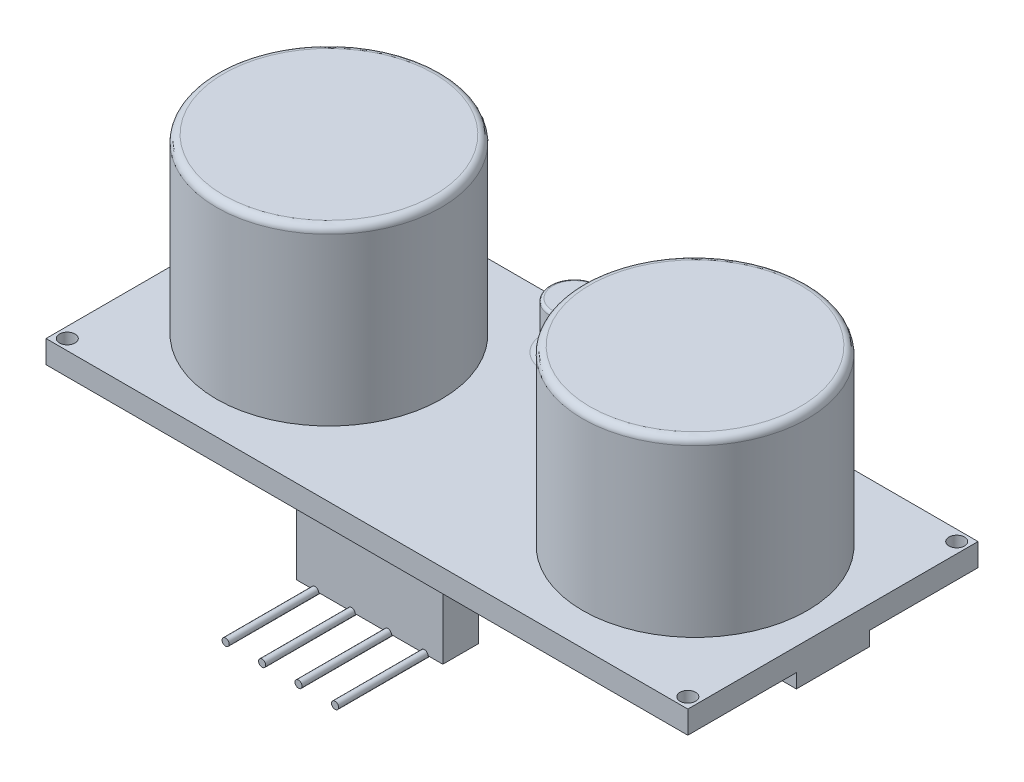
from build123d import *

# Parameters (mm, degrees)
SKETCH1_W           = 45.23
SKETCH1_H           = 20.45
BOSS_EXTRUDE1_DEPTH = 1.6
SKETCH2_R           = 7.92
BOSS_EXTRUDE2_DEPTH = 12.2
BOSS_EXTRUDE3_DEPTH = 3.3
SKETCH4_W           = 4
SKETCH4_H           = 10.1
SKETCH4_W_2         = 8.68
SKETCH4_H_2         = 5.15
SKETCH4_W_3         = 10.3
SKETCH4_H_3         = 2.53
BOSS_EXTRUDE4_DEPTH = 1
SKETCH5_W           = 10.3
SKETCH5_H           = 2.53
BOSS_EXTRUDE5_DEPTH = 3.5
SKETCH6_R           = 0.25
BOSS_EXTRUDE6_DEPTH = 6.3
FILLET1_R           = 0.5
FILLET2_R           = 0.5
FILLET3_R           = 0.2
FILLET4_R           = 0.5
SKETCH7_R           = 0.55
CUT_EXTRUDE1_DEPTH  = 6.3


with BuildPart() as part:
    # Sketch1 → Boss-Extrude1 (new body)
    with BuildSketch(Plane(origin=(0, 0, 0), x_dir=(1, 0, 0), z_dir=(0, 1, 0))):
        with Locations((-22.615, 10.225)):
            Rectangle(SKETCH1_W, SKETCH1_H)
    extrude(amount=BOSS_EXTRUDE1_DEPTH)

    # Sketch2 → Boss-Extrude2 (add)
    with BuildSketch(Plane(origin=(0, 1.6, 0), x_dir=(1, 0, 0), z_dir=(0, 1, 0))):
        with Locations(Location((-35.515, 10.225, 0), (0, 0, 270))):
            Circle(SKETCH2_R)
        with Locations(Location((-9.715, 10.225, 0), (0, 0, 270))):
            Circle(SKETCH2_R)
    extrude(amount=BOSS_EXTRUDE2_DEPTH)

    # Sketch3 → Boss-Extrude3 (add)
    with BuildSketch(Plane(origin=(0, 1.6, 0), x_dir=(1, 0, 0), z_dir=(0, 1, 0))):
        with BuildLine():
            Line((-25.77, 19.5), (-19.46, 19.5))
            ThreePointArc((-19.46, 19.5), (-17.74, 17.78), (-19.46, 16.06))
            Line((-19.46, 16.06), (-25.77, 16.06))
            ThreePointArc((-25.77, 16.06), (-27.49, 17.78), (-25.77, 19.5))
        make_face()
    extrude(amount=BOSS_EXTRUDE3_DEPTH)

    # Sketch4 → Boss-Extrude4 (add)
    with BuildSketch(Plane.XZ):
        with Locations((-40.73, -10.225)):
            Rectangle(SKETCH4_W, SKETCH4_H)
        with Locations((-22.615, -10.225)):
            Rectangle(SKETCH4_W_2, SKETCH4_H_2)
        with Locations((-4.34, -10.225)):
            Rectangle(SKETCH4_W_2, SKETCH4_H_2)
        with Locations((-22.615, -1.465)):
            Rectangle(SKETCH4_W_3, SKETCH4_H_3)
    extrude(amount=BOSS_EXTRUDE4_DEPTH)

    # Sketch5 → Boss-Extrude5 (add)
    with BuildSketch(Plane.XZ.offset(1)):
        with Locations((-22.615, -1.465)):
            Rectangle(SKETCH5_W, SKETCH5_H)
    extrude(amount=BOSS_EXTRUDE5_DEPTH)

    # Sketch6 → Boss-Extrude6 (add)
    with BuildSketch(Plane.XY.offset(-0.2)):
        with Locations((-21.334010663, -4.5)):
            Circle(SKETCH6_R)
        with Locations((-18.759010663, -4.5)):
            Circle(SKETCH6_R)
        with Locations(Location((-23.895989337, -4.5, 0), (0, 0, 180))):
            Circle(SKETCH6_R)
        with Locations(Location((-26.470989337, -4.5, 0), (0, 0, 180))):
            Circle(SKETCH6_R)
    extrude(amount=BOSS_EXTRUDE6_DEPTH)

    # Fillet1
    # the kernel refuses this fillet: 0.5 mm, written as the material it adds along each edge
    with BuildSketch(Plane(origin=(-24.970989337, -4.5, -0.2), x_dir=(0, 0, -1), z_dir=(-1, 0, 0))) as fillet1_piece_1_section:
        with BuildLine():
            CenterArc((FILLET1_R, FILLET1_R), FILLET1_R, 180, 90)
            Line((0, FILLET1_R), (0, 0))
            Line((0, 0), (FILLET1_R, 0))
        make_face()
    fillet1_piece_1 = extrude(amount=3, mode=Mode.PRIVATE)
    fillet1_piece_1 = fillet1_piece_1 & Plane(origin=(-26.470989337, -4.5, -0.330121351), x_dir=(-1, 0, 0), z_dir=(0, 0, -1)) * Cylinder(0.25, 8, mode=Mode.PRIVATE)
    add(fillet1_piece_1)
    with BuildSketch(Plane(origin=(-22.395989337, -4.5, -0.2), x_dir=(0, 0, -1), z_dir=(-1, 0, 0))) as fillet1_piece_2_section:
        with BuildLine():
            CenterArc((FILLET1_R, FILLET1_R), FILLET1_R, 180, 90)
            Line((0, FILLET1_R), (0, 0))
            Line((0, 0), (FILLET1_R, 0))
        make_face()
    fillet1_piece_2 = extrude(amount=3, mode=Mode.PRIVATE)
    fillet1_piece_2 = fillet1_piece_2 & Plane(origin=(-23.895989337, -4.5, -0.330121351), x_dir=(-1, 0, 0), z_dir=(0, 0, -1)) * Cylinder(0.25, 8, mode=Mode.PRIVATE)
    add(fillet1_piece_2)
    with BuildSketch(Plane(origin=(-19.834010663, -4.5, -0.2), x_dir=(0, 0, -1), z_dir=(-1, 0, 0))) as fillet1_piece_3_section:
        with BuildLine():
            CenterArc((FILLET1_R, FILLET1_R), FILLET1_R, 180, 90)
            Line((0, FILLET1_R), (0, 0))
            Line((0, 0), (FILLET1_R, 0))
        make_face()
    fillet1_piece_3 = extrude(amount=3, mode=Mode.PRIVATE)
    fillet1_piece_3 = fillet1_piece_3 & Plane(origin=(-21.334010663, -4.5, -0.330121598), x_dir=(1, 0, 0), z_dir=(0, 0, -1)) * Cylinder(0.25, 8, mode=Mode.PRIVATE)
    add(fillet1_piece_3)
    with BuildSketch(Plane(origin=(-17.259010663, -4.5, -0.2), x_dir=(0, 0, -1), z_dir=(-1, 0, 0))) as fillet1_piece_4_section:
        with BuildLine():
            CenterArc((FILLET1_R, FILLET1_R), FILLET1_R, 180, 90)
            Line((0, FILLET1_R), (0, 0))
            Line((0, 0), (FILLET1_R, 0))
        make_face()
    fillet1_piece_4 = extrude(amount=3, mode=Mode.PRIVATE)
    fillet1_piece_4 = fillet1_piece_4 & Plane(origin=(-18.759010663, -4.5, -0.330121598), x_dir=(1, 0, 0), z_dir=(0, 0, -1)) * Cylinder(0.25, 8, mode=Mode.PRIVATE)
    add(fillet1_piece_4)

    # Fillet2
    fillet2_edges = [part.edges().sort_by_distance(p)[0] for p in [
        (-35.515, 13.8, -18.145),
        (-9.715, 13.8, -18.145),
    ]]
    fillet(fillet2_edges, radius=FILLET2_R)

    # Fillet3
    fillet3_edges = [part.edges().sort_by_distance(p)[0] for p in [
        (-27.49, 4.9, -17.78),
        (-22.615, 4.9, -16.06),
        (-17.74, 4.9, -17.78),
        (-22.615, 4.9, -19.5),
    ]]
    fillet(fillet3_edges, radius=FILLET3_R)

    # Fillet4
    fillet4_edges = [part.edges().sort_by_distance(p)[0] for p in [
        (-27.49, 1.6, -17.78),
        (-22.615, 1.6, -16.06),
        (-17.74, 1.6, -17.78),
        (-22.615, 1.6, -19.5),
    ]]
    fillet(fillet4_edges, radius=FILLET4_R)

    # Sketch7 → Cut-Extrude1 (cut)
    with BuildSketch(Plane(origin=(0, 1.6, 0), x_dir=(1, 0, 0), z_dir=(0, 1, 0))):
        with Locations(Location((-44.48, 19.7, 0), (0, 0, 270))):
            Circle(SKETCH7_R)
        with Locations(Location((-44.48, 0.75, 0), (0, 0, 270))):
            Circle(SKETCH7_R)
        with Locations(Location((-0.75, 0.75, 0), (0, 0, 270))):
            Circle(SKETCH7_R)
        with Locations(Location((-0.75, 19.7, 0), (0, 0, 270))):
            Circle(SKETCH7_R)
    extrude(amount=-CUT_EXTRUDE1_DEPTH, mode=Mode.SUBTRACT)


solid = part.part
